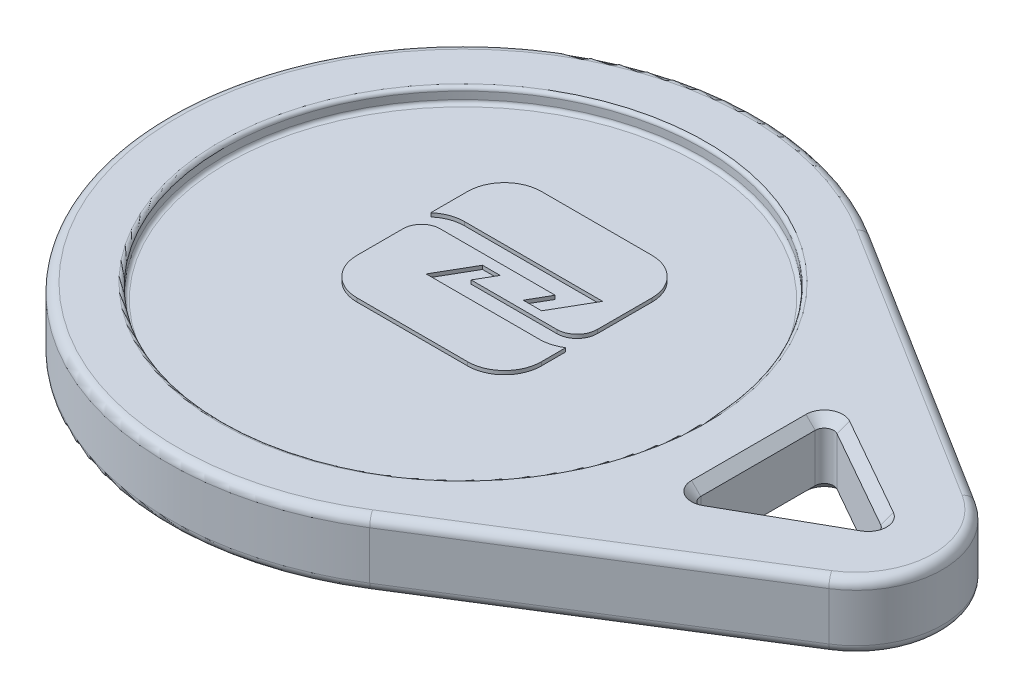
from build123d import *

# Parameters (mm, degrees)
BOSS_EXTRUDE1_DEPTH = 1.8
CUT_EXTRUDE1_START  = -1
SKETCH1_4_R         = 13
CUT_EXTRUDE1_DEPTH  = 10
FILLET1_R           = 0.5
CHAMFER1_SIZE       = 0.5
FILLET2_R           = 0.5
FILLET3_R           = 0.2
WRAP1_DEPTH         = 0.2
SKETCH4_R           = 0.3409814
SKETCH4_R_2         = 0.156360859
SKETCH4_R_3         = 0.161662901
BOSS_EXTRUDE2_DEPTH = 0.5


# Read off the part's stored shape, not the designer's step: Wrap1
with BuildPart() as part:
    # Sketch1 → Boss-Extrude1 (new, symmetric)
    with BuildSketch(Plane(origin=(0, 0, 0), x_dir=(1, 0, 0), z_dir=(0, 1, 0))):
        with BuildLine():
            Line((23.807737397, 3.961267476), (8.497069168, 13.557279062))
            ThreePointArc((8.497069168, 13.557279062), (-16, 0), (8.497069168, -13.557279062))
            Line((8.497069168, -13.557279062), (23.807737397, -3.961267476))
            ThreePointArc((23.807737397, -3.961267476), (26, 0), (23.807737397, 3.961267476))
        make_face()
        Polygon((16, 3.961267476), (23, 0), (16, -3.961267476), align=None, mode=Mode.SUBTRACT)
    extrude(amount=BOSS_EXTRUDE1_DEPTH, both=True)

    # Sketch1<4> → Cut-Extrude1 (cut)
    with BuildSketch(Plane(origin=(0, 0, 0), x_dir=(1, 0, 0), z_dir=(0, 1, 0)).offset(CUT_EXTRUDE1_START)):
        with Locations(Location((0, 0, 0), (0, 0, 270))):
            Circle(SKETCH1_4_R)
    cut_extrude1 = extrude(amount=-CUT_EXTRUDE1_DEPTH, mode=Mode.SUBTRACT)

    # Mirror1: Cut-Extrude1 across plane
    add(cut_extrude1.mirror(Plane.ZX), mode=Mode.SUBTRACT)

    # Fillet1
    fillet1_edges = [part.edges().sort_by_distance(p)[0] for p in [
        (16, 0, -3.961267476),
        (16, 0, 3.961267476),
        (23, 0, 0),
    ]]
    fillet(fillet1_edges, radius=FILLET1_R)

    # Chamfer1
    chamfer1_edges = [part.edges().sort_by_distance(p)[0] for p in [
        (16, -1.8, 0),
        (16, 1.8, 0),
        (19.488642475, -1.8, 1.987060909),
        (19.488642475, 1.8, 1.987060909),
        (19.488642475, -1.8, -1.987060909),
        (19.488642475, 1.8, -1.987060909),
        (16.248133063, -1.8, 3.535741292),
        (16.248133063, 1.8, 3.535741292),
        (22.48478058, -1.8, 0),
        (22.48478058, 1.8, 0),
        (16.248133063, -1.8, -3.535741292),
        (16.248133063, 1.8, -3.535741292),
    ]]
    chamfer(chamfer1_edges, length=CHAMFER1_SIZE)

    # Fillet2
    fillet2_edges = [part.edges().sort_by_distance(p)[0] for p in [
        (16.152403283, -1.8, 8.759273269),
        (-16, -1.8, 0),
        (-16, 1.8, 0),
        (16.152403283, 1.8, 8.759273269),
        (26, 1.8, 0),
        (16.152403283, 1.8, -8.759273269),
        (16.152403283, -1.8, -8.759273269),
        (26, -1.8, 0),
    ]]
    fillet(fillet2_edges, radius=FILLET2_R)

    # Fillet3
    fillet3_edges = [part.edges().sort_by_distance(p)[0] for p in [
        (0, -1.8, -13),
        (0, -1, -13),
        (0, 1.8, -13),
        (0, 1, -13),
    ]]
    fillet(fillet3_edges, radius=FILLET3_R)

    # Wrap1 outline → Wrap1 (add)
    with BuildSketch(Plane(origin=(0, 1, 0), x_dir=(1, 0, 0), z_dir=(0, 1, 0))):
        with BuildLine():
            Line((4.077350269, 3.5), (2.864914704, 1.4))
            Line((2.864914704, 1.4), (1.864914704, 1.4))
            Line((1.864914704, 1.4), (2.5, 2.5))
            Line((2.5, 2.5), (-3.75, 2.5))
            ThreePointArc((-3.75, 2.5), (-4.457106781, 2.207106781), (-4.75, 1.5))
            Line((-4.75, 1.5), (-4.75, -1))
            ThreePointArc((-4.75, -1), (-4.164213562, -2.414213562), (-2.75, -3))
            Line((-2.75, -3), (3.25, -3))
            ThreePointArc((3.25, -3), (4.664213562, -2.414213562), (5.25, -1))
            Line((5.25, -1), (5.25, 0.321654439))
            ThreePointArc((5.25, 0.321654439), (4.723927409, 0.082067743), (4.151721991, 0))
            Line((4.151721991, 0), (-2, 0))
            Line((-2, 0), (-0.881346073, 1.937565437))
            Line((-0.881346073, 1.937565437), (0.077350269, 1.937565437))
            Line((0.077350269, 1.937565437), (-0.5, 0.937565437))
            Line((-0.5, 0.937565437), (4.151721991, 0.937565437))
            ThreePointArc((4.151721991, 0.937565437), (4.928321819, 1.259243619), (5.25, 2.035843447))
            Line((5.25, 2.035843447), (5.25, 5))
            ThreePointArc((5.25, 5), (4.664213562, 6.414213562), (3.25, 7))
            Line((3.25, 7), (-2.75, 7))
            ThreePointArc((-2.75, 7), (-4.164213562, 6.414213562), (-4.75, 5))
            Line((-4.75, 5), (-4.75, 3))
            ThreePointArc((-4.75, 3), (-4.134231125, 3.370828693), (-3.427124344, 3.5))
            Line((-3.427124344, 3.5), (4.077350269, 3.5))
        make_face()
    extrude(amount=WRAP1_DEPTH)

    # Sketch4 → Boss-Extrude2 (add)
    # profile 1 of 12: a face of its own
    with BuildSketch(Plane.XZ.offset(1)):
        with BuildLine():
            add(Edge.make_bspline(
                [(6.333242243, -0.922908681), (6.152651307, -0.73693638), (5.796616826, -0.798629908), (5.362692218, -1.037825781), (5.248610309, -1.426507043), (5.566302434, -1.859317726), (5.222110195, -1.844871085), (5.01906278, -1.867272333), (4.748769449, -1.792882184), (4.650306208, -1.479104027), (4.733181372, -1.255467081), (4.64254864, -1.125003252)],
                knots=[0, 0, 0, 0, 0.205806194, 0.330131626, 0.445094274, 0.577384444, 0.626199241, 0.709268721, 0.795714785, 0.856255846, 1, 1, 1, 1], degree=3))
            Line((4.64254864, -1.125003252), (4.376375303, -1.125003252))
            Line((4.376375303, -1.125003252), (4.376375303, -2.081255611))
            add(Edge.make_bspline(
                [(4.376375303, -2.081255611), (4.432201386, -2.24121269), (4.160799066, -2.459968844), (3.9019905, -2.598933921), (3.720800233, -2.549523518)],
                knots=[0, 0, 0, 0, 0.461952368, 1, 1, 1, 1], degree=3))
            Line((3.720800233, -2.549523518), (3.720800233, -2.840342534))
            Line((3.720800233, -2.840342534), (4.006690113, -2.840342534))
            add(Edge.make_bspline(
                [(4.006690113, -2.840342534), (4.198058383, -2.741514921), (4.615944337, -2.629465048), (4.582759503, -2.016475154), (4.853709039, -2.08223376), (4.898863705, -2.130546969)],
                knots=[0, 0, 0, 0, 0.541528556, 0.829611505, 1, 1, 1, 1], degree=3))
            Line((4.898863705, -2.130546969), (6.244517798, -2.130546969))
            add(Edge.make_bspline(
                [(6.244517798, -2.130546969), (6.390720152, -2.155071533), (6.683847115, -1.993615434), (6.58411531, -1.71082512), (6.347150615, -1.764251152), (6.124364746, -1.853943096), (5.789337323, -1.835674772), (5.59569354, -1.622028316), (5.559295183, -1.39649974), (5.595097959, -1.183675366), (5.796321691, -1.108865587), (6.003697019, -1.067959232), (6.237647789, -1.070185454), (6.425501899, -1.094274753), (6.333242243, -0.922908681)],
                knots=[0, 0, 0, 0, 0.174086907, 0.206678444, 0.254661398, 0.374250214, 0.474403848, 0.5633522, 0.63912513, 0.704815473, 0.7551377, 0.839505292, 0.918925354, 1, 1, 1, 1], degree=3))
        make_face()
    # profile 2 of 12: a face of its own
    with BuildSketch(Plane.XZ.offset(1)):
        with BuildLine():
            Line((3.583681713, -1.938734513), (3.583681713, -0.043482048))
            ThreePointArc((3.583681713, -0.043482048), (3.436406184, 0.103793481), (3.289130655, -0.043482048))
            Line((3.289130655, -0.043482048), (3.289130655, -1.938734513))
            ThreePointArc((3.289130655, -1.938734513), (3.436406184, -2.086010042), (3.583681713, -1.938734513))
        make_face()
    # profile 3 of 12: a face of its own
    with BuildSketch(Plane.XZ.offset(1)):
        with BuildLine():
            Line((2.89107792, -0.858829915), (2.638818611, -0.858829915))
            Line((2.638818611, -0.858829915), (2.638818611, -1.56862548))
            ThreePointArc((2.638818611, -1.56862548), (2.317781029, -1.889663062), (1.996743447, -1.56862548))
            Line((1.996743447, -1.56862548), (1.996743447, -1.213727698))
            ThreePointArc((1.996743447, -1.213727698), (1.878865696, -1.095849947), (1.760987946, -1.213727698))
            Line((1.760987946, -1.213727698), (1.760987946, -1.603129431))
            ThreePointArc((1.760987946, -1.603129431), (1.448639089, -1.915478288), (1.136290233, -1.603129431))
            Line((1.136290233, -1.603129431), (0.990590512, -1.213727698))
            ThreePointArc((0.990590512, -1.213727698), (0.829085509, -1.140173246), (0.755531058, -1.301678249))
            Line((0.755531058, -1.301678249), (0.921807645, -1.746074371))
            add(Edge.make_bspline(
                [(0.921807645, -1.746074371), (0.988731513, -2.065046994), (0.699131511, -2.402989366), (0.160022408, -2.606628274), (-0.193445704, -2.43906138), (-0.536050092, -2.10909333), (-0.488910205, -1.690042482), (-0.48050766, -1.480449661)],
                knots=[0, 0, 0, 0, 0.308021104, 0.480073812, 0.603269546, 0.730648782, 1, 1, 1, 1], degree=3))
            Line((-0.48050766, -1.480449661), (-0.741125583, -1.480449661))
            Line((-0.741125583, -1.480449661), (-0.741125583, -2.130546969))
            add(Edge.make_bspline(
                [(1.136290233, -2.081255611), (1.145580947, -2.261013063), (0.990084191, -2.548639717), (0.583667663, -2.759521275), (0.158811251, -2.837368228), (-0.389645007, -2.696170953), (-0.700528146, -2.394788911), (-0.741125583, -2.130546969)],
                knots=[0, 0, 0, 0, 0.207199211, 0.350331682, 0.528526688, 0.703839327, 1, 1, 1, 1], degree=3))
            Line((1.136290233, -2.081255611), (1.248581527, -2.081255611))
            add(Edge.make_bspline(
                [(1.878865696, -1.938734513), (1.784218942, -2.212886191), (1.45223907, -2.192054219), (1.248581527, -2.081255611)],
                knots=[0, 0, 0, 0, 1, 1, 1, 1], degree=3))
            Line((1.878865696, -1.938734513), (1.944828826, -1.938734513))
            ThreePointArc((1.944828826, -1.938734513), (2.51252644, -2.183211121), (2.89107792, -1.694592488))
            Line((2.89107792, -1.694592488), (2.89107792, -0.858829915))
        make_face()
    # profile 4 of 12: a face of its own
    with BuildSketch(Plane.XZ.offset(1)):
        with BuildLine():
            Line((-2.0288892, -0.99110828), (-2.316361403, -0.99110828))
            add(Edge.make_bspline(
                [(-3.64055826, -1.746074371), (-3.62078413, -1.845090427), (-3.43291129, -1.915146377), (-3.140645333, -1.941699097), (-2.894403242, -1.743737816), (-2.79151247, -1.464359511), (-2.589060076, -1.203150491), (-2.425403988, -1.039360522), (-2.316361403, -0.99110828)],
                knots=[0, 0, 0, 0, 0.137491764, 0.319969627, 0.456340655, 0.62385753, 0.805008671, 1, 1, 1, 1], degree=3))
            Line((-3.64055826, -1.746074371), (-3.64055826, -1.213727698))
            Line((-3.64055826, -1.213727698), (-3.92970251, -1.213727698))
            add(Edge.make_bspline(
                [(-4.583419946, -2.549523518), (-4.399990436, -2.606387262), (-4.115541715, -2.473044509), (-3.935714036, -2.117135199), (-3.926127158, -1.711508717), (-3.930807726, -1.408306331), (-3.92970251, -1.213727698)],
                knots=[0, 0, 0, 0, 0.311394054, 0.472354866, 0.665866862, 1, 1, 1, 1], degree=3))
            Line((-4.583419946, -2.549523518), (-4.583419946, -2.804218259))
            add(Edge.make_bspline(
                [(-3.68665372, -2.081255611), (-3.6607488, -2.224113606), (-3.772000818, -2.413935654), (-3.895536701, -2.711770841), (-4.211930952, -2.839353787), (-4.43975726, -2.858465607), (-4.583419946, -2.804218259)],
                knots=[0, 0, 0, 0, 0.287546015, 0.495076155, 0.674605891, 1, 1, 1, 1], degree=3))
            add(Edge.make_bspline(
                [(-1.641691485, -1.79536573), (-1.666840449, -1.949294146), (-1.857710932, -2.14305062), (-2.149976437, -2.176832475), (-2.372712462, -2.213798751), (-2.493849513, -2.076421277), (-2.625149455, -2.049545877), (-2.689437822, -1.970928804), (-2.811761298, -1.974544122), (-2.889397792, -2.110843423), (-3.089606401, -2.136678944), (-3.278040269, -2.135082637), (-3.437759469, -2.117890083), (-3.597234765, -2.168451051), (-3.619464553, -2.033939571), (-3.68665372, -2.081255611)],
                knots=[0, 0, 0, 0, 0.195594458, 0.300942932, 0.382078499, 0.462570992, 0.513718545, 0.547494273, 0.585106376, 0.648855259, 0.7269739, 0.825481789, 0.891750732, 0.941900203, 1, 1, 1, 1], degree=3))
            Line((-1.641691485, -1.79536573), (-1.641691485, -1.430609676))
            add(Edge.make_bspline(
                [(-2.0288892, -0.99110828), (-1.827860507, -1.047258675), (-1.673394394, -1.228023447), (-1.641691485, -1.430609676)],
                knots=[0, 0, 0, 0, 1, 1, 1, 1], degree=3))
        make_face()
        with BuildLine():
            Line((-2.521602521, -1.746074371), (-2.521602521, -1.603129431))
            add(Edge.make_bspline(
                [(-2.521602521, -1.603129431), (-2.492334975, -1.440246194), (-2.33644307, -1.304147285), (-2.049924037, -1.269221147), (-1.935564354, -1.432664838), (-1.938628907, -1.590185992), (-1.906686585, -1.753232308), (-2.049947594, -1.882392881), (-2.284032844, -1.918090421), (-2.467271089, -1.845799526), (-2.521602521, -1.746074371)],
                knots=[0, 0, 0, 0, 0.243189446, 0.342255455, 0.43507335, 0.532917111, 0.613193193, 0.692984217, 0.822015692, 1, 1, 1, 1], degree=3))
        make_face(mode=Mode.SUBTRACT)
    # profile 5 of 12: a face of its own
    with BuildSketch(Plane.XZ.offset(1)):
        with BuildLine():
            Line((-4.783434641, -1.79536573), (-4.783434641, -1.213727698))
            add(Edge.make_bspline(
                [(-4.783434641, -1.79536573), (-4.824626247, -1.972373158), (-5.082609938, -2.174891731), (-5.46565669, -2.123017338), (-5.716552021, -2.128212135), (-5.909027666, -2.135990111), (-6.064062941, -2.106550826), (-6.119952934, -1.978218371), (-6.246531485, -1.976415363), (-6.296035993, -2.11766076), (-6.507083066, -2.135765048), (-6.731953114, -2.13378142), (-6.962385921, -2.114922307), (-7.129530975, -2.000160622), (-7.129625142, -1.827241597), (-7.278568937, -1.794630725), (-7.435538006, -1.775518059), (-7.51692836, -1.938888536), (-7.651640256, -2.098517501), (-7.557704501, -2.380573905), (-7.636548682, -2.666882822), (-7.453856953, -3.056092466), (-7.772872757, -3.100176047), (-7.845132562, -2.909141472), (-7.860387723, -2.710307594), (-7.873135187, -2.425509637), (-7.883604211, -2.192288644), (-7.904226433, -1.959853423), (-7.805248945, -1.802335577), (-7.715877479, -1.614918948), (-7.526610027, -1.637050417), (-7.484000824, -1.451789879), (-7.240107055, -1.571219302), (-7.280118023, -1.299206038), (-7.108826459, -1.208255594), (-7.052922245, -1.015687631), (-6.904667007, -0.845990028), (-6.696284872, -0.811357278), (-6.499890325, -0.785234559), (-6.325038897, -0.926474676), (-6.249666502, -1.122547283), (-6.139472083, -1.279553479), (-6.041579092, -1.468550633), (-6.064615491, -1.62302055), (-6.054470837, -1.829295509), (-5.874385842, -1.768090684), (-5.696366192, -1.893716109), (-5.447167951, -1.826394719), (-5.21619113, -1.883760085), (-5.009287163, -1.717301998), (-5.060900356, -1.480498351), (-5.096872973, -1.289195149), (-4.989424085, -1.143198574), (-4.855443989, -1.058758218), (-4.783434641, -1.213727698)],
                knots=[0, 0, 0, 0, 0.04897659, 0.079355714, 0.106921957, 0.119861214, 0.134674701, 0.147924513, 0.153550277, 0.1660123, 0.182436723, 0.207190084, 0.232376601, 0.246460101, 0.259924151, 0.273316563, 0.284005514, 0.30196594, 0.317550505, 0.341741471, 0.375519082, 0.408135021, 0.426734106, 0.435040447, 0.461755044, 0.484487024, 0.515083437, 0.528904566, 0.548374396, 0.567601273, 0.580443187, 0.592275954, 0.607465516, 0.627763193, 0.639598751, 0.659096672, 0.681905575, 0.698772114, 0.717899711, 0.735347358, 0.757207921, 0.776713089, 0.790116505, 0.81505061, 0.82482195, 0.836073478, 0.855330541, 0.884021936, 0.903712109, 0.91947848, 0.949250194, 0.965565204, 0.97057816, 1, 1, 1, 1], degree=3))
        make_face()
        with Locations(Location((-6.680794907, -1.534992554, 0), (0, 0, 270))):
            Circle(SKETCH4_R, mode=Mode.SUBTRACT)
    # profile 6 of 12: a face of its own
    with BuildSketch(Plane.XZ.offset(1)):
        with BuildLine():
            Line((-4.310488796, 0.840914524), (-4.293941807, 1.20033922))
            add(Edge.make_bspline(
                [(-5.127967546, 3.434305613), (-4.79646808, 3.366861195), (-4.275310463, 2.991810988), (-3.808653274, 2.236085129), (-3.437698887, 1.530652512), (-3.332169325, 0.507518747), (-3.957853299, 0.469739023), (-3.961233692, 0.910690491), (-4.125129134, 1.217725317), (-4.248771352, 1.655013827), (-4.293941807, 1.20033922)],
                knots=[0, 0, 0, 0, 0.195769607, 0.368537703, 0.506032539, 0.719219719, 0.747311083, 0.828202206, 0.901832109, 1, 1, 1, 1], degree=3))
            add(Edge.make_bspline(
                [(-4.783434641, 6.078654778), (-4.828895347, 5.805371141), (-4.834855339, 5.319335389), (-4.574233372, 4.774612296), (-4.516141489, 4.324513041), (-4.333115577, 3.97649236), (-4.243493315, 3.6087439), (-4.119741757, 3.406069581), (-4.13402268, 3.086999953), (-4.272629046, 3.404490203), (-4.35448128, 3.621504506), (-4.500789684, 4.008892173), (-4.649685212, 4.299714786), (-4.741044332, 4.960998359), (-4.795621688, 3.905010331), (-4.836137353, 3.683491624), (-5.127967546, 3.434305613)],
                knots=[0, 0, 0, 0, 0.138740215, 0.231208348, 0.295905012, 0.360210821, 0.426702613, 0.472894939, 0.498286697, 0.527034638, 0.577641632, 0.648599401, 0.71023499, 0.771232279, 0.854161593, 1, 1, 1, 1], degree=3))
            add(Edge.make_bspline(
                [(-4.709505915, 6.481241488), (-4.77636123, 6.250551779), (-4.450795905, 5.833261315), (-3.892743257, 5.341833845), (-3.229420173, 4.896066377), (-2.620945088, 4.187397393), (-2.309026062, 3.367726513), (-2.403040729, 2.657505381), (-2.256387888, 2.085744378), (-2.602201067, 1.987341197), (-2.787856493, 2.165618854), (-3.065253474, 2.439580169), (-3.477704432, 2.840914697), (-3.837062088, 3.399628748), (-4.092480731, 4.034234055), (-4.364238513, 4.636007628), (-4.274076393, 5.233814941), (-4.598711308, 5.639307031), (-4.648161157, 5.958221206), (-4.783434641, 6.078654778)],
                knots=[0, 0, 0, 0, 0.066706788, 0.136163485, 0.225566009, 0.296875073, 0.410711195, 0.460948459, 0.521564899, 0.535690482, 0.551277942, 0.591418723, 0.654141604, 0.717769781, 0.784837097, 0.855594553, 0.90765167, 0.950625324, 1, 1, 1, 1], degree=3))
            add(Edge.make_bspline(
                [(-4.640117827, 6.648555505), (-4.666719264, 6.641807214), (-4.520826162, 6.429727053), (-4.30257613, 6.353740914), (-3.95190803, 5.974390073), (-3.349141509, 5.582983148), (-2.601213426, 5.178024651), (-1.967074646, 4.880258246), (-1.504114606, 4.825717684), (-1.027683705, 4.764950147), (-0.527337027, 5.608802217), (0.44803904, 5.944060126), (1.652787654, 6.423745879), (2.834144185, 6.379238404), (3.766159094, 5.913585829), (4.502644653, 5.550424686), (4.404695073, 5.043732548), (4.116948726, 5.043178231), (3.922615507, 5.221440356), (3.543499027, 5.266826867), (3.094801409, 5.128253856), (2.765830042, 5.073599364), (2.334306903, 5.066047082), (2.726991745, 4.830907089), (3.037955579, 4.612232757), (3.517746252, 4.171675357), (3.79927659, 3.732351309), (3.888764425, 3.409401679), (3.878769759, 3.202115825), (3.773619235, 2.997916348), (3.55537816, 2.851410099), (3.25693611, 2.761603112), (2.916810483, 2.823991809), (2.666107072, 2.607081165), (2.377950269, 2.429158307), (1.976577298, 2.400566857), (1.669706337, 2.303162242), (1.246398382, 2.432429717), (1.278394588, 2.21483547), (1.397748604, 1.966794798), (1.719849397, 1.715898548), (2.079635625, 1.381179863), (2.08839406, 0.880944986), (1.634904475, 0.557817653), (1.051758314, 0.45243394), (0.423480828, 0.655594604), (0.028257047, 0.778684389), (-0.446883326, 1.270261091), (-0.115118636, 0.730238783), (0.080311971, 0.472913596), (0.429947331, 0.201365719), (0.5575203, -0.109610025), (0.549935342, -0.39670946), (0.295452541, -0.553896303), (-0.040140576, -0.517701164), (-0.456246301, -0.169159045), (-0.997238069, 0.332994547), (-1.465400553, 1.10609118), (-1.749319738, 1.946475815), (-1.902750504, 2.724584853), (-1.814978577, 3.501760506), (-1.860861771, 4.08195907), (-1.416278429, 4.721720899), (-2.040004663, 4.739411446), (-2.429379825, 5.003497714), (-3.016124947, 5.15861538), (-3.550717535, 5.570226479), (-4.152141166, 5.967974932), (-4.501644521, 6.307913985), (-4.709505915, 6.481241488)],
                knots=[0.19610017, 0.19610017, 0.19610017, 0.19610017, 0.200331897, 0.20613307, 0.216046851, 0.234076086, 0.258063994, 0.276335929, 0.282688988, 0.291535652, 0.307744242, 0.342961218, 0.363100679, 0.4001601, 0.419911622, 0.441690434, 0.445986298, 0.450562974, 0.458378513, 0.464439135, 0.476623609, 0.489941953, 0.493097162, 0.499387762, 0.508270742, 0.527991441, 0.541182443, 0.545283435, 0.551601631, 0.555357535, 0.561164288, 0.569619767, 0.577124821, 0.583985346, 0.591781451, 0.601160262, 0.610839053, 0.618352806, 0.620605429, 0.62414583, 0.63843375, 0.648511155, 0.657922395, 0.669328562, 0.684294707, 0.699359569, 0.71292648, 0.720786559, 0.728494055, 0.740016501, 0.7502783, 0.757357702, 0.763818436, 0.768221978, 0.776874998, 0.785772845, 0.806127282, 0.82924781, 0.84880304, 0.868918644, 0.885075382, 0.902925093, 0.913362714, 0.92444467, 0.933155007, 0.948905215, 0.965637794, 0.980764766, 1, 1, 1, 1], degree=3))
            add(Edge.make_bspline(
                [(-4.550073429, 6.961567789), (-4.197265854, 7.19736253), (-3.495964042, 7.378317147), (-2.645220015, 7.312930632), (-1.92720225, 7.29317328), (-1.438043393, 7.049712138), (-0.66282717, 7.016140133), (-0.782243171, 6.608635528), (-0.987686912, 6.602647842), (-1.111868037, 6.463551611), (-1.305882335, 6.330632054), (-1.58856476, 6.184752451), (-1.927375226, 6.096501289), (-2.248557778, 5.93762988), (-2.613780359, 5.990260837), (-2.977258192, 5.914079386), (-3.360654627, 6.075404784), (-3.727283782, 6.108023328), (-4.050357647, 6.307085286), (-4.338194738, 6.436411652), (-4.481089709, 6.577993895), (-4.625607971, 6.652236386), (-4.640117827, 6.648555505)],
                knots=[0, 0, 0, 0, 0.029488812, 0.049438101, 0.061125323, 0.078655559, 0.093487204, 0.09780742, 0.102425665, 0.106160411, 0.110611733, 0.119133229, 0.128490789, 0.135510213, 0.14385668, 0.153924578, 0.160971251, 0.172726933, 0.17935076, 0.187910643, 0.193791959, 0.19610017, 0.19610017, 0.19610017, 0.19610017], degree=3))
            ThreePointArc((-4.550073429, 6.961567789), (-4.885590287, 6.82012146), (-5.206750293, 6.648555505))
            add(Edge.make_bspline(
                [(-5.206750293, 6.648555505), (-5.223142324, 6.277501102), (-5.246300014, 5.906813723)],
                knots=[0, 0, 0, 1, 1, 1], degree=2))
            add(Edge.make_bspline(
                [(-5.246300014, 5.906813723), (-5.455321304, 5.767179666), (-5.798180186, 5.563305395), (-6.160851057, 5.120965695), (-6.442678386, 4.693319098), (-6.656721985, 4.359927409), (-6.631270996, 4.145176992)],
                knots=[0, 0, 0, 0, 0.328392113, 0.507120966, 0.734773813, 1, 1, 1, 1], degree=3))
            add(Edge.make_bspline(
                [(-6.631270996, 4.145176992), (-6.387409737, 4.092708811), (-6.010672448, 4.136742794), (-5.541013841, 4.409323988), (-5.401231487, 4.615994153), (-5.210619313, 4.911937742), (-5.26233439, 4.562038484), (-5.234400684, 4.325337422), (-5.272594931, 3.941406274), (-5.411815748, 3.627893108), (-5.713198924, 3.447916653), (-6.031824284, 3.556169824), (-6.449700333, 3.407779772), (-7.198854269, 3.023873576), (-7.766781633, 2.476043595), (-7.957998587, 1.944315765)],
                knots=[0, 0, 0, 0, 0.119484943, 0.187953107, 0.247028086, 0.271429069, 0.303820812, 0.349550332, 0.419623869, 0.4803631, 0.513062864, 0.582683078, 0.630388612, 0.72714119, 1, 1, 1, 1], degree=3))
            add(Edge.make_bspline(
                [(-7.957998587, 1.944315765), (-8.03521896, 1.727951537), (-8.191091359, 1.502412012), (-7.955091375, 1.08793917), (-7.813055602, 1.309352465), (-7.51612825, 1.511511044), (-7.34333154, 1.836299076), (-7.144462782, 1.990629033)],
                knots=[0, 0, 0, 0, 0.330639936, 0.419238116, 0.519756997, 0.606747701, 1, 1, 1, 1], degree=3))
            add(Edge.make_bspline(
                [(-4.310488796, 0.840914524), (-4.409273921, 0.771927899), (-4.622426041, 0.181215261), (-5.147066817, 0.480293954), (-5.160080536, 0.866544813), (-5.34678918, 1.188216737), (-5.316279618, 1.926119497), (-5.601270721, 1.04594358), (-6.027805893, 0.821802674), (-6.439383232, 0.335007653), (-7.109578813, 0.551419206), (-7.144385609, 1.140290412), (-7.218414212, 1.576937963), (-6.929988298, 2.416531527), (-7.144462782, 1.990629033)],
                knots=[0, 0, 0, 0, 0.114197544, 0.160342152, 0.238833312, 0.281853279, 0.358171068, 0.447007095, 0.529839628, 0.627475326, 0.72061923, 0.788295924, 0.882019816, 1, 1, 1, 1], degree=3))
        make_face()
        with BuildLine():
            add(Edge.make_bspline(
                [(-5.811773911, 3.36691649), (-6.133267386, 3.360551312), (-6.672116983, 3.253322955), (-7.153154366, 2.78211326), (-7.545010038, 2.52453158), (-7.725435228, 2.127631255), (-7.902221255, 1.776353057), (-7.952464787, 1.49795167), (-7.957998587, 1.36916608)],
                knots=[0, 0, 0, 0, 0.310298031, 0.476972584, 0.629790187, 0.738270824, 0.878541036, 1, 1, 1, 1], degree=3))
            ThreePointArc((-5.811773911, 3.36691649), (-5.774267986, 3.336353814), (-5.810534786, 3.304330529))
            add(Edge.make_bspline(
                [(-5.810534786, 3.304330529), (-6.040303991, 3.271412345), (-6.315283983, 3.151215334), (-6.680364286, 2.922421605), (-6.831518502, 2.812730513), (-7.16400766, 2.591908554), (-6.935865547, 2.629232961), (-6.926649797, 2.658121772)],
                knots=[0, 0, 0, 0, 0.426527175, 0.61777776, 0.770567733, 0.919791631, 1, 1, 1, 1], degree=3))
            add(Edge.make_bspline(
                [(-6.926649797, 2.658121772), (-6.725911239, 2.793800696), (-6.513794911, 2.910956434), (-6.303793671, 3.03126013)],
                knots=[0, 0, 0, 0, 1, 1, 1, 1], degree=3))
            ThreePointArc((-6.303793671, 3.03126013), (-6.241841182, 3.042961224), (-6.258942797, 2.982277114))
            add(Edge.make_bspline(
                [(-7.806266125, 1.446585949), (-7.597517179, 1.597136673), (-7.426950979, 1.940942258), (-7.041596858, 2.237130642), (-6.777256403, 2.460817899), (-6.522687271, 2.716283157), (-6.339627695, 2.880725416), (-6.258942797, 2.982277114)],
                knots=[0, 0, 0, 0, 0.346577851, 0.505083258, 0.662605072, 0.822522234, 1, 1, 1, 1], degree=3))
            add(Edge.make_bspline(
                [(-7.957998587, 1.36916608), (-7.976836054, 1.179076834), (-7.806266125, 1.446585949)],
                knots=[0, 0, 0, 1, 1, 1], degree=2))
        make_face(mode=Mode.SUBTRACT)
        with BuildLine():
            ThreePointArc((-5.559222328, 3.145965361), (-5.474813886, 3.146609742), (-5.486026543, 3.062946867))
            Line((-5.486026543, 3.062946867), (-5.486026543, 1.783287114))
            Line((-5.486026543, 1.783287114), (-5.518658324, 1.631567988))
            add(Edge.make_bspline(
                [(-6.904185369, 2.160920578), (-7.069752973, 1.901121099), (-7.035849107, 1.518731189), (-7.046568632, 1.049533922), (-7.035072358, 0.80327261), (-6.810441025, 0.578189653), (-6.712763647, 0.835362776), (-6.636611549, 1.218439844), (-6.573245419, 0.839425186), (-6.778134884, 0.58963191), (-6.403330904, 0.611105656), (-6.272561459, 0.813377382), (-6.005560558, 0.91036822), (-5.752961363, 1.184600025), (-5.543254744, 1.404318071), (-5.518658324, 1.631567988)],
                knots=[0, 0, 0, 0, 0.200066484, 0.275799541, 0.33100504, 0.385930532, 0.426099327, 0.4982756, 0.547491751, 0.610510521, 0.653524845, 0.736399414, 0.784753455, 0.848770362, 1, 1, 1, 1], degree=3))
            ThreePointArc((-6.904185369, 2.160920578), (-6.818628442, 2.245495421), (-6.733071515, 2.160920578))
            add(Edge.make_bspline(
                [(-6.926649797, 1.341844461), (-6.940682021, 1.774071328), (-6.733071515, 2.160920578)],
                knots=[0, 0, 0, 1, 1, 1], degree=2))
            add(Edge.make_bspline(
                [(-5.767196367, 3.233326518), (-5.956531508, 3.110277522), (-6.187381144, 2.8690297), (-6.498030022, 2.513406168), (-6.623445332, 2.184634441), (-6.765970755, 1.792940672), (-6.786960342, 1.458076084), (-6.896372097, 1.005623667), (-6.926649797, 1.341844461)],
                knots=[0, 0, 0, 0, 0.255341982, 0.38599848, 0.535368056, 0.659081258, 0.847438722, 1, 1, 1, 1], degree=3))
            ThreePointArc((-5.767196367, 3.233326518), (-5.670211186, 3.229577036), (-5.719498828, 3.145965361))
            add(Edge.make_bspline(
                [(-5.719498828, 3.145965361), (-5.867895663, 3.018124864), (-6.043487768, 2.758282133), (-6.228846281, 2.359104765), (-6.339708917, 2.017812973), (-6.470216045, 1.664768492), (-6.461729341, 1.102318389), (-6.258942797, 1.410075521)],
                knots=[0, 0, 0, 0, 0.264087546, 0.417375682, 0.601822508, 0.730431373, 1, 1, 1, 1], degree=3))
            add(Edge.make_bspline(
                [(-6.258942797, 1.410075521), (-6.290068942, 1.682163878), (-6.180291303, 2.095390932), (-5.938509233, 2.688941248), (-5.724180009, 3.000525395), (-5.559222328, 3.145965361)],
                knots=[0, 0, 0, 0, 0.417989033, 0.65909893, 1, 1, 1, 1], degree=3))
        make_face(mode=Mode.SUBTRACT)
        with BuildLine():
            Line((-4.685921946, 2.853618736), (-4.235594131, 2.296109989))
            add(Edge.make_bspline(
                [(-4.685921946, 2.946828578), (-4.758784052, 3.153026078), (-3.535226791, 1.665709334), (-4.255488462, 2.211270513), (-4.235594131, 2.296109989)],
                knots=[0, 0, 0, 0, 0.778825597, 1, 1, 1, 1], degree=3))
            add(Edge.make_bspline(
                [(-3.615415282, 0.798125099), (-3.637679877, 1.188591686), (-3.59779915, 1.908616749), (-4.102865813, 2.460157489), (-4.35428995, 2.871240092), (-4.666111042, 3.012950639), (-4.91313071, 3.188325255), (-4.685921946, 2.946828578)],
                knots=[0, 0, 0, 0, 0.428579454, 0.636309936, 0.749140141, 0.901824461, 1, 1, 1, 1], degree=3))
            ThreePointArc((-3.615415282, 0.798125099), (-3.651755003, 0.656829226), (-3.796665999, 0.673737884))
            add(Edge.make_bspline(
                [(-4.944902691, 2.982277114), (-4.600582714, 2.579395422), (-4.301080689, 1.767720529), (-3.832603171, 1.02750668), (-3.796665999, 0.673737884)],
                knots=[0, 0, 0, 0, 0.599703137, 1, 1, 1, 1], degree=3))
            Line((-4.944902691, 2.982277114), (-4.87075766, 2.982277114))
            Line((-4.87075766, 2.982277114), (-4.685921946, 2.853618736))
        make_face(mode=Mode.SUBTRACT)
        with BuildLine():
            add(Edge.make_bspline(
                [(-1.455481891, 4.429125018), (-1.67072809, 4.031902176), (-1.592303499, 3.338851399), (-1.714458803, 2.47514074), (-1.576733677, 1.679905044), (-1.204050438, 0.9735392), (-0.68384133, 0.311302655), (-0.307943664, -0.154408984), (0.09069571, -0.399677048), (0.399447182, -0.297750966), (0.354748721, 0.035095603), (0.091968836, 0.286948932), (-0.197316929, 0.679939849), (-0.541207501, 1.124570915), (-0.795138297, 1.651764219), (-1.048198365, 2.176944032), (-1.150793841, 2.69100934), (-1.221775184, 3.024564345), (-1.312844951, 3.145965361)],
                knots=[0, 0, 0, 0, 0.136572499, 0.211404114, 0.272428164, 0.385972644, 0.457246666, 0.536267918, 0.574267836, 0.595936732, 0.619958877, 0.660441447, 0.7111539, 0.772048598, 0.836219588, 0.894016663, 0.953834026, 1, 1, 1, 1], degree=3))
            add(Edge.make_bspline(
                [(-1.312844951, 3.145965361), (-1.370646641, 2.775173418), (-1.17565374, 2.082308705), (-1.104432125, 1.252050064), (0.030185519, 0.195971906), (-1.043433465, 0.961945833), (-1.221733699, 1.516399028), (-1.371645846, 2.170481589), (-1.520075136, 3.119312479), (-1.425432623, 3.906963994), (-1.455481891, 4.429125018)],
                knots=[0, 0, 0, 0, 0.159049187, 0.273663994, 0.402965995, 0.507162488, 0.597466607, 0.674954038, 0.780636442, 1, 1, 1, 1], degree=3))
        make_face(mode=Mode.SUBTRACT)
        with BuildLine():
            add(Edge.make_bspline(
                [(-1.108179659, 4.565791746), (-1.06316044, 4.674961533), (-0.635923188, 4.539268782), (-0.217415683, 4.448049773), (0.31387055, 3.975656241), (0.712651462, 3.394975441), (0.956388515, 2.788598167), (1.128173892, 2.365716313), (1.270773768, 1.955757648), (1.534533186, 1.674515354), (1.804811943, 1.437405131), (1.863347098, 1.17577131), (1.849282456, 0.92698298), (1.685552195, 0.7313217), (1.418635719, 0.624297623), (1.097904637, 0.645389977), (0.732179354, 0.717844764), (0.322536551, 0.821782775), (-0.02914115, 1.071302725), (-0.355535847, 1.339548078), (-0.634193368, 1.707238883), (-0.854329427, 2.147712396), (-1.032887771, 2.680314728), (-1.136876523, 3.019709789), (-1.283250991, 3.695760331), (-1.053244958, 3.11434386), (-0.8810071, 2.75829514), (-0.531435025, 2.224666226), (-0.060293874, 1.708551621), (0.25571302, 1.473040161), (0.86680866, 1.22410634), (0.423896416, 1.509626893), (0.144371154, 1.668303791), (-0.208550399, 2.045242961), (-0.535537172, 2.396203679), (-0.773518626, 2.853036428), (-0.968232821, 3.280628793), (-1.130960927, 3.72267265), (-1.167226266, 3.975815388), (-1.239061661, 4.380526873), (-1.045407899, 4.036387078), (-0.862674469, 3.861800306), (-0.703763934, 3.491553811), (-0.476529829, 3.137748641), (-0.288834138, 2.729843372), (-0.121497799, 2.516696887), (0.056911745, 2.021225256), (0.047760315, 2.299802239), (0.005190831, 2.506226395), (-0.221542371, 2.797484708), (-0.30759596, 3.235812308), (-0.613420574, 3.603669408), (-0.760496549, 4.082097973), (-1.109491446, 4.281348248), (-1.122744601, 4.530472352), (-1.108179659, 4.565791746)],
                knots=[0, 0, 0, 0, 0.019334916, 0.039056622, 0.067804864, 0.109883597, 0.13672647, 0.156909898, 0.17285709, 0.195583301, 0.209165738, 0.220839379, 0.230978597, 0.242391234, 0.253564386, 0.269371699, 0.285553963, 0.305082668, 0.32663154, 0.343977735, 0.363062875, 0.389178409, 0.412493308, 0.435688251, 0.45250514, 0.467875737, 0.487593659, 0.51915031, 0.551479709, 0.577287326, 0.592409091, 0.601536181, 0.626639721, 0.647914407, 0.668687812, 0.69318754, 0.717476362, 0.734450737, 0.754699967, 0.761618187, 0.773534429, 0.783814788, 0.803829155, 0.824059895, 0.844183359, 0.86015878, 0.875047645, 0.879470224, 0.889954002, 0.9067876, 0.927223296, 0.950188253, 0.971021915, 0.993744629, 1, 1, 1, 1], degree=3))
        make_face(mode=Mode.SUBTRACT)
        with BuildLine():
            Line((-6.071268173, 4.272421475), (-6.500546016, 4.272421475))
            add(Edge.make_bspline(
                [(-5.246300014, 5.727173136), (-5.60147242, 5.678705871), (-5.78885737, 5.222474948), (-6.291003997, 4.786276817), (-6.418095125, 4.443337252), (-6.500546016, 4.272421475)],
                knots=[0, 0, 0, 0, 0.460237687, 0.707670118, 1, 1, 1, 1], degree=3))
            Line((-5.246300014, 5.727173136), (-5.298453733, 5.366333248))
            Line((-5.298453733, 5.366333248), (-6.215707697, 4.534187858))
            Line((-6.215707697, 4.534187858), (-6.154738864, 4.466983372))
            Line((-6.154738864, 4.466983372), (-5.298453733, 5.243817001))
            add(Edge.make_bspline(
                [(-6.071268173, 4.272421475), (-5.854396536, 4.39366585), (-5.48048908, 4.628994044), (-5.23508111, 5.039322245), (-5.298453733, 5.243817001)],
                knots=[0, 0, 0, 0, 0.5614389, 1, 1, 1, 1], degree=3))
        make_face(mode=Mode.SUBTRACT)
        with BuildLine():
            add(Edge.make_bspline(
                [(-5.415427022, 3.467431675), (-5.242353442, 3.605950614), (-5.008137542, 4.283997622), (-5.084078382, 4.982183986), (-5.06961987, 5.460609683)],
                knots=[0, 0, 0, 0, 0.306314527, 1, 1, 1, 1], degree=3))
            Line((-5.06961987, 5.460609683), (-5.06961987, 6.481241488))
            Line((-5.06961987, 6.481241488), (-4.93845164, 6.593692886))
            add(Edge.make_bspline(
                [(-4.93845164, 6.593692886), (-5.039427958, 5.992821458), (-4.875774976, 5.240895415), (-4.844224789, 4.243575017), (-4.990016978, 3.720405378), (-5.205275858, 3.359678814), (-5.415427022, 3.467431675)],
                knots=[0, 0, 0, 0, 0.515323604, 0.677494272, 0.859151323, 1, 1, 1, 1], degree=3))
        make_face(mode=Mode.SUBTRACT)
        with BuildLine():
            add(Edge.make_bspline(
                [(-4.217917029, 5.295079092), (-4.422468907, 5.617461543), (-4.10309931, 5.369446657), (-3.794728891, 5.134414572), (-3.35580794, 4.798157529), (-2.890758034, 4.328634391), (-2.469776204, 3.435166329), (-2.522456377, 2.896073998), (-2.522306913, 2.091378802), (-2.708595872, 2.329316539), (-2.889131359, 2.438031738), (-3.171808742, 2.747889759), (-3.536411797, 3.157112175), (-3.980385551, 3.984064567), (-4.142807266, 4.676015722), (-4.217917029, 5.147687369)],
                knots=[0, 0, 0, 0, 0.053438418, 0.105429254, 0.171484038, 0.259385806, 0.365677793, 0.521047326, 0.54864707, 0.571844274, 0.599511029, 0.641185949, 0.727253794, 0.814733946, 1, 1, 1, 1], degree=3))
            Line((-4.217917029, 5.147687369), (-4.132056819, 4.999166131))
            Line((-4.132056819, 4.999166131), (-2.928173875, 2.853618736))
            ThreePointArc((-2.928173875, 2.853618736), (-2.851996527, 2.842378359), (-2.860345548, 2.918926568))
            Line((-2.860345548, 2.918926568), (-4.217917029, 5.295079092))
        make_face(mode=Mode.SUBTRACT)
        with BuildLine():
            add(Edge.make_bspline(
                [(-1.91138992, 6.610784535), (-2.228751109, 6.511977905), (-2.802024194, 6.495866492), (-3.501159754, 6.593151682), (-4.046729692, 6.61548883), (-4.427523978, 6.615784267), (-4.454657768, 6.872390975)],
                knots=[0, 0, 0, 0, 0.367002639, 0.640786997, 0.780136569, 1, 1, 1, 1], degree=3))
            add(Edge.make_bspline(
                [(-4.454657768, 6.872390975), (-4.161111081, 6.705103333), (-3.660877733, 6.685228786), (-2.846389406, 6.64600386), (-2.399895934, 6.606682655), (-1.411285294, 6.899690033), (-1.81550316, 6.499047455), (-1.91138992, 6.610784535)],
                knots=[0, 0, 0, 0, 0.305536761, 0.484977118, 0.729770257, 0.897617489, 1, 1, 1, 1], degree=3))
        make_face(mode=Mode.SUBTRACT)
        with BuildLine():
            Line((-1.08494414, 4.731472721), (-1.08494414, 4.78327177))
            add(Edge.make_bspline(
                [(-1.08494414, 4.78327177), (-0.817848659, 5.063280201), (-0.194901448, 5.282693638), (0.648004705, 5.197344056), (1.24140041, 5.266353013), (1.671047078, 5.147002203), (2.055741596, 5.048782223), (2.667966489, 4.741991261), (3.066443961, 4.328744582), (3.355636613, 4.066207365)],
                knots=[0, 0, 0, 0, 0.226921254, 0.384338988, 0.516147971, 0.586256617, 0.654961641, 0.759152182, 1, 1, 1, 1], degree=3))
            add(Edge.make_bspline(
                [(3.355636613, 4.066207365), (3.50896765, 3.91881168), (3.675682113, 3.673437615), (3.758928788, 3.224804453), (3.48199494, 2.983597356), (3.159841778, 2.921483908), (2.717417904, 2.857285622), (2.34327611, 2.616279274), (1.865158685, 2.593021256), (1.420491775, 2.805130998), (0.999812064, 3.136596581), (0.795567387, 3.441752217), (0.555262465, 3.747518531), (0.735901497, 3.672356067)],
                knots=[0, 0, 0, 0, 0.127435929, 0.20596776, 0.253742862, 0.344473383, 0.414043304, 0.538678417, 0.621408881, 0.707147183, 0.853019154, 0.935252352, 1, 1, 1, 1], degree=3))
            add(Edge.make_bspline(
                [(0.735901497, 3.672356067), (1.11035651, 3.269687304), (1.555335274, 2.946828578)],
                knots=[0, 0, 0, 1, 1, 1], degree=2))
            ThreePointArc((1.555335274, 2.946828578), (1.619394266, 2.954606228), (1.606914445, 3.017917367))
            add(Edge.make_bspline(
                [(-0.741125583, 4.689711042), (-0.436639845, 4.668694262), (0.019500274, 4.420558096), (0.549582027, 3.994831451), (1.073056428, 3.562906054), (1.393845712, 3.220547133), (1.606914445, 3.017917367)],
                knots=[0, 0, 0, 0, 0.305212341, 0.520217947, 0.698422826, 1, 1, 1, 1], degree=3))
            Line((-0.741125583, 4.689711042), (-1.08494414, 4.731472721))
        make_face(mode=Mode.SUBTRACT)
        with BuildLine():
            add(Edge.make_bspline(
                [(1.563954024, 5.366333248), (1.774263766, 5.208804477), (2.147902745, 5.207597548), (2.733453812, 5.192277888), (3.075439554, 5.25028421), (3.289130655, 5.295079092)],
                knots=[0, 0, 0, 0, 0.414491289, 0.626533236, 1, 1, 1, 1], degree=3))
            add(Edge.make_bspline(
                [(1.563954024, 5.366333248), (1.845877877, 5.46976504), (2.278071574, 5.599471862), (2.888331586, 5.509566212), (3.182438205, 5.428286618), (3.502063527, 5.302481993), (3.289130655, 5.295079092)],
                knots=[0, 0, 0, 0, 0.44510434, 0.672579578, 0.865618447, 1, 1, 1, 1], degree=3))
        make_face(mode=Mode.SUBTRACT)
        with BuildLine():
            add(Edge.make_bspline(
                [(4.060564407, 5.295079092), (3.718992873, 5.378818139), (3.285081052, 5.633352443), (2.671233251, 5.676816579), (2.277843033, 5.683872635), (1.816862291, 5.615586968), (1.516175204, 5.466597592), (1.33780548, 5.392635851)],
                knots=[0, 0, 0, 0, 0.3760957, 0.510693627, 0.648371044, 0.794065721, 1, 1, 1, 1], degree=3))
            Line((1.33780548, 5.392635851), (-0.275575633, 5.392635851))
            add(Edge.make_bspline(
                [(-0.275575633, 5.392635851), (0.050629321, 5.628305165), (0.625645387, 5.844433029), (1.413065208, 6.132643639), (2.073298106, 6.236460519), (2.722992923, 6.137315892), (3.399931788, 6.009783034), (3.829976068, 5.681437464), (4.350110612, 5.451342846), (4.194631142, 5.14041017), (4.060564407, 5.295079092)],
                knots=[0, 0, 0, 0, 0.229979136, 0.353633288, 0.485390009, 0.60955044, 0.735031205, 0.868998551, 0.945116874, 1, 1, 1, 1], degree=3))
        make_face(mode=Mode.SUBTRACT)
    # profile 7 of 12: a face of its own
    with BuildSketch(Plane.XZ.offset(1)):
        with Locations(Location((-5.647837753, -2.593287165, 0), (0, 0, 90))):
            Circle(SKETCH4_R_2)
    # profile 8 of 12: a face of its own
    with BuildSketch(Plane.XZ.offset(1)):
        with Locations(Location((-5.124158011, -2.593287165, 0), (0, 0, 90))):
            Circle(SKETCH4_R_3)
    # profile 9 of 12: a face of its own
    with BuildSketch(Plane.XZ.offset(1)):
        with BuildLine():
            add(Edge.make_bspline(
                [(5.837481239, -0.356287787), (6.051919843, -0.511652445), (6.09471018, -0.226922657), (6.137500517, 0.057807131), (5.880271576, -0.071557999), (5.623042634, -0.200923129), (5.837481239, -0.356287787)],
                knots=[0, 0, 0, 2.094395102, 2.094395102, 4.188790205, 4.188790205, 6.283185307, 6.283185307, 6.283185307], degree=2, weights=[1, 0.5, 1, 0.5, 1, 0.5, 1]))
        make_face()
    # profile 10 of 12: a face of its own
    with BuildSketch(Plane.XZ.offset(1)):
        with BuildLine():
            add(Edge.make_bspline(
                [(2.032702212, 0), (1.873491339, 0.222666079), (1.683406037, -0.081501442), (1.493320735, -0.385668962), (1.84261691, -0.304167521), (2.191913085, -0.222666079), (2.032702212, 0)],
                knots=[0, 0, 0, 2.094395102, 2.094395102, 4.188790205, 4.188790205, 6.283185307, 6.283185307, 6.283185307], degree=2, weights=[1, 0.5, 1, 0.5, 1, 0.5, 1]))
        make_face()
    # profile 11 of 12: a face of its own
    with BuildSketch(Plane.XZ.offset(1)):
        with BuildLine():
            add(Edge.make_bspline(
                [(1.996743447, -0.577180074), (1.863281144, -0.84410468), (2.176586685, -0.833929572), (2.489892226, -0.823754463), (2.310048988, -0.567004965), (2.13020575, -0.310255467), (1.996743447, -0.577180074)],
                knots=[0, 0, 0, 2.094395102, 2.094395102, 4.188790205, 4.188790205, 6.283185307, 6.283185307, 6.283185307], degree=2, weights=[1, 0.5, 1, 0.5, 1, 0.5, 1]))
        make_face()
    # profile 12 of 12: a face of its own
    with BuildSketch(Plane.XZ.offset(1)):
        with BuildLine():
            add(Edge.make_bspline(
                [(1.760987946, -0.659371537), (1.760987946, -0.39244693), (1.465437062, -0.525909234), (1.169886179, -0.659371537), (1.465437062, -0.79283384), (1.760987946, -0.926296143), (1.760987946, -0.659371537)],
                knots=[0, 0, 0, 2.094395102, 2.094395102, 4.188790205, 4.188790205, 6.283185307, 6.283185307, 6.283185307], degree=2, weights=[1, 0.5, 1, 0.5, 1, 0.5, 1]))
        make_face()
    extrude(amount=BOSS_EXTRUDE2_DEPTH)


solid = part.part
